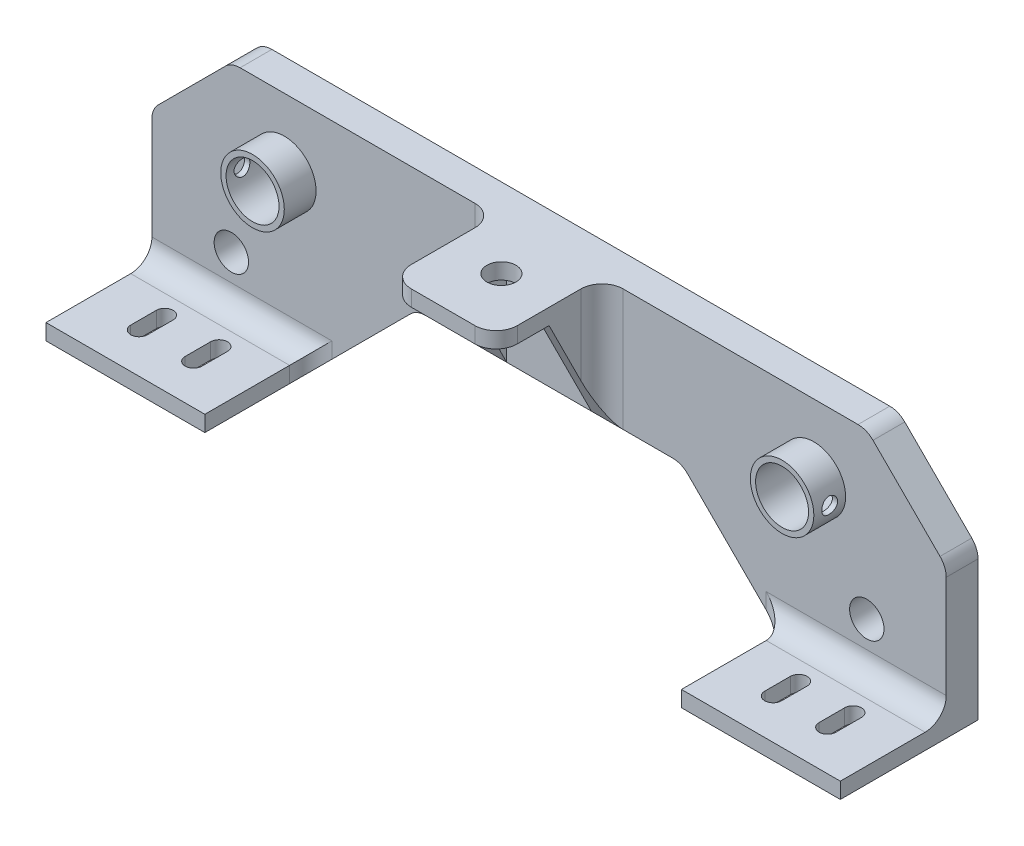
from build123d import *

# Parameters (mm, degrees)
CROQUIS1_R                            = 3.25
CROQUIS1_R_2                          = 5
SALIENTE_EXTRUIR1_DEPTH               = 6
CROQUIS2_R                            = 6
CROQUIS2_R_2                          = 5
SALIENTE_EXTRUIR2_DEPTH               = 6
CROQUIS4_W                            = 20
CROQUIS4_H                            = 3
SALIENTE_EXTRUIR3_DEPTH               = 20
CROQUIS11_R                           = 2.75
CORTAR_EXTRUIR2_DEPTH                 = 10
NERVIO2_REACH                         = 100.742
CROQUIS7_WALL_W                       = 221.844856356
CROQUIS7_WALL_H                       = 2
CROQUIS8_W                            = 30
CROQUIS8_H                            = 3
SALIENTE_EXTRUIR4_DEPTH               = 20
DI_METRO_DE_TALADRO_1_8_0_125_2_DEPTH = 3
CROQUIS12_R                           = 1.5
CORTAR_EXTRUIR3_DEPTH                 = 10
REDONDEO1_R                           = 4


# Read off the part's stored shape, not the designer's step: Diámetro de taladro 1/8 (0.125)2
with BuildPart() as part:
    # Croquis1 → Saliente-Extruir1 (new body)
    with BuildSketch(Plane.XY):
        Polygon((60, 43), (-60, 43), (-75, 28), (-75, 0), (-45, 0), (-25, 20), (25, 20), (45, 0), (75, 0), (75, 28), align=None)
        with Locations((-60, 12)):
            Circle(CROQUIS1_R, mode=Mode.SUBTRACT)
        with Locations((60, 12)):
            Circle(CROQUIS1_R, mode=Mode.SUBTRACT)
        with Locations((-50, 30)):
            Circle(CROQUIS1_R_2, mode=Mode.SUBTRACT)
        with Locations((50, 30)):
            Circle(CROQUIS1_R_2, mode=Mode.SUBTRACT)
    extrude(amount=SALIENTE_EXTRUIR1_DEPTH)

    # Croquis2 → Saliente-Extruir2 (add)
    # profile 1 of 2: a face of its own
    with BuildSketch(Plane.XY.offset(6)):
        with Locations((-50, 30)):
            Circle(CROQUIS2_R)
        with Locations((-50, 30)):
            Circle(CROQUIS2_R_2, mode=Mode.SUBTRACT)
    # profile 2 of 2: a face of its own
    with BuildSketch(Plane.XY.offset(6)):
        with Locations((50, 30)):
            Circle(CROQUIS2_R)
        with Locations((50, 30)):
            Circle(CROQUIS2_R_2, mode=Mode.SUBTRACT)
    extrude(amount=SALIENTE_EXTRUIR2_DEPTH)

    # Croquis4 → Saliente-Extruir3 (add)
    with BuildSketch(Plane.XY.offset(6)):
        with Locations((0, 41.5)):
            Rectangle(CROQUIS4_W, CROQUIS4_H)
    extrude(amount=SALIENTE_EXTRUIR3_DEPTH)

    # Croquis11 → Cortar-Extruir2 (cut)
    with BuildSketch(Plane(origin=(0, 43, 0), x_dir=(1, 0, 0), z_dir=(0, 1, 0))):
        with Locations(Location((0, -15, 0), (0, 0, 180))):
            Circle(CROQUIS11_R)
    extrude(amount=-CORTAR_EXTRUIR2_DEPTH, mode=Mode.SUBTRACT)

    # Croquis7 wall → Nervio2 (add, up to next)
    with BuildSketch(Plane(origin=(-10, 30, 11), x_dir=(0, -0.894427191, -0.4472135955), z_dir=(0, -0.4472135955, 0.894427191)), mode=Mode.PRIVATE) as nervio2_sk1:
        with Locations((0, 1)):
            Rectangle(CROQUIS7_WALL_W, CROQUIS7_WALL_H)
    nervio2_tool1 = extrude(nervio2_sk1.sketch, amount=-NERVIO2_REACH, mode=Mode.PRIVATE) - part.part
    nervio2 = nervio2_tool1.solids().sort_by_distance((-10, 30, 11))[0]
    add(nervio2)

    # Croquis8 → Saliente-Extruir4 (add)
    with BuildSketch(Plane.XY.offset(6)):
        with Locations((-60, 1.5)):
            Rectangle(CROQUIS8_W, CROQUIS8_H)
    saliente_extruir4 = extrude(amount=SALIENTE_EXTRUIR4_DEPTH)

    # Diámetro de taladro 1/8 (0.125)2 outline → Diámetro de taladro 1/8 (0.125)2 (cut)
    with BuildSketch(Plane(origin=(0, 0, 0), x_dir=(1, 0, 0), z_dir=(0, 1, 0))):
        with BuildLine():
            Line((-53.142177149, -18.4125), (-53.142177149, -13.5875))
            ThreePointArc((-53.142177149, -13.5875), (-54.729677149, -12), (-56.317177149, -13.5875))
            Line((-56.317177149, -13.5875), (-56.317177149, -18.4125))
            ThreePointArc((-56.317177149, -18.4125), (-54.729677149, -20), (-53.142177149, -18.4125))
        make_face()
        with BuildLine():
            Line((-63.4125, -18.4125), (-63.4125, -13.5875))
            ThreePointArc((-63.4125, -13.5875), (-65, -12), (-66.5875, -13.5875))
            Line((-66.5875, -13.5875), (-66.5875, -18.4125))
            ThreePointArc((-66.5875, -18.4125), (-65, -20), (-63.4125, -18.4125))
        make_face()
    di_metro_de_taladro_1_8_0_125_2 = extrude(amount=DI_METRO_DE_TALADRO_1_8_0_125_2_DEPTH, mode=Mode.SUBTRACT)

    # Croquis12 → Cortar-Extruir3 (cut)
    with BuildSketch(Plane(origin=(-50, 0, 0), x_dir=(0, 0, -1), z_dir=(1, 0, 0))):
        with Locations(Location((-9, 30, 0), (0, 0, 180))):
            Circle(CROQUIS12_R)
    cortar_extruir3 = extrude(amount=-CORTAR_EXTRUIR3_DEPTH, mode=Mode.SUBTRACT)

    # Simetría2: Nervio2, Saliente-Extruir4, Diámetro de taladro 1/8 (0.125)2, Cortar-Extruir3 across plane
    add(nervio2.mirror(Plane(origin=(0, 0, 0), x_dir=(0, 0, 1), z_dir=(1, 0, 0))))
    add(saliente_extruir4.mirror(Plane(origin=(0, 0, 0), x_dir=(0, 0, 1), z_dir=(1, 0, 0))))
    add(di_metro_de_taladro_1_8_0_125_2.mirror(Plane(origin=(0, 0, 0), x_dir=(0, 0, 1), z_dir=(1, 0, 0))), mode=Mode.SUBTRACT)
    add(cortar_extruir3.mirror(Plane(origin=(0, 0, 0), x_dir=(0, 0, 1), z_dir=(1, 0, 0))), mode=Mode.SUBTRACT)

    # Redondeo1
    # the kernel refuses this fillet: 4 mm, written as the material it adds along each edge
    with BuildSketch(Plane(origin=(-45, 3, 6), x_dir=(0, 1, 0), z_dir=(-1, 0, 0))) as redondeo1_piece_1:
        with BuildLine():
            CenterArc((REDONDEO1_R, -REDONDEO1_R), REDONDEO1_R, 90, 90)
            Line((0, -REDONDEO1_R), (0, 0))
            Line((0, 0), (REDONDEO1_R, 0))
        make_face()
    extrude(amount=30)
    with BuildSketch(Plane(origin=(45, 0, 6), x_dir=(-1, 0, 0), z_dir=(0, 1, 0))) as redondeo1_piece_2_section:
        with BuildLine():
            CenterArc((REDONDEO1_R, REDONDEO1_R), REDONDEO1_R, 180, 90)
            Line((0, REDONDEO1_R), (0, 0))
            Line((0, 0), (REDONDEO1_R, 0))
        make_face()
    redondeo1_piece_2 = extrude(amount=3, mode=Mode.PRIVATE)
    redondeo1_piece_2 = split(redondeo1_piece_2, bisect_by=Plane(origin=(43.821771507, 1.178228493, 7.107331066), z_dir=(0.7071067811865477, 0.7071067811865474, 0)), keep=Keep.TOP, mode=Mode.PRIVATE)
    add(redondeo1_piece_2)
    with BuildSketch(Plane(origin=(45, 3, 6), x_dir=(0, 1, 0), z_dir=(1, 0, 0))) as redondeo1_piece_3:
        with BuildLine():
            CenterArc((REDONDEO1_R, REDONDEO1_R), REDONDEO1_R, 180, 90)
            Line((0, REDONDEO1_R), (0, 0))
            Line((0, 0), (REDONDEO1_R, 0))
        make_face()
    extrude(amount=30)
    with BuildSketch(Plane(origin=(-25, 20, 0), x_dir=(-0.7071067811865421, -0.7071067811865528, 0), z_dir=(0, 0, 1)), Plane(origin=(25, 20, 0), x_dir=(-1, 0, 0), z_dir=(0, 0, 1))) as redondeo1_piece_4:
        with BuildLine():
            CenterArc((REDONDEO1_R * 0.414213562373, REDONDEO1_R), REDONDEO1_R, 225, 45)
            Line((-REDONDEO1_R * 0.292893218813, REDONDEO1_R * 0.292893218813), (0, 0))
            Line((0, 0), (REDONDEO1_R * 0.414213562373, 0))
        make_face()
    extrude(amount=6)
    with BuildSketch(Plane(origin=(-10, 20, 6), x_dir=(-1, 0, 0), z_dir=(0, 1, 0))) as redondeo1_piece_5_section:
        with BuildLine():
            CenterArc((REDONDEO1_R, REDONDEO1_R), REDONDEO1_R, 180, 90)
            Line((0, REDONDEO1_R), (0, 0))
            Line((0, 0), (REDONDEO1_R, 0))
        make_face()
    redondeo1_piece_5 = extrude(amount=23, mode=Mode.PRIVATE)
    redondeo1_piece_5 = split(redondeo1_piece_5, bisect_by=Plane(origin=(-10.946740329, 30.205569968, 11.102784984), z_dir=(0, 0.447213595499958, -0.894427190999916)), keep=Keep.TOP, mode=Mode.PRIVATE)
    add(redondeo1_piece_5)
    with BuildSketch(Plane(origin=(10, 43, 6), x_dir=(1, 0, 0), z_dir=(0, -1, 0))) as redondeo1_piece_6_section:
        with BuildLine():
            CenterArc((REDONDEO1_R, REDONDEO1_R), REDONDEO1_R, 180, 90)
            Line((0, REDONDEO1_R), (0, 0))
            Line((0, 0), (REDONDEO1_R, 0))
        make_face()
    redondeo1_piece_6 = extrude(amount=23, mode=Mode.PRIVATE)
    redondeo1_piece_6 = split(redondeo1_piece_6, bisect_by=Plane(origin=(10.946740329, 30.205569968, 11.102784984), z_dir=(0, 0.447213595499958, -0.894427190999916)), keep=Keep.TOP, mode=Mode.PRIVATE)
    add(redondeo1_piece_6)
    with BuildSketch(Plane(origin=(-45, 0, 6), x_dir=(1, 0, 0), z_dir=(0, 1, 0))) as redondeo1_piece_7_section:
        with BuildLine():
            CenterArc((REDONDEO1_R, -REDONDEO1_R), REDONDEO1_R, 90, 90)
            Line((0, -REDONDEO1_R), (0, 0))
            Line((0, 0), (REDONDEO1_R, 0))
        make_face()
    redondeo1_piece_7 = extrude(amount=3, mode=Mode.PRIVATE)
    redondeo1_piece_7 = split(redondeo1_piece_7, bisect_by=Plane(origin=(-43.821771507, 1.178228493, 7.107331066), z_dir=(-0.7071067811865537, 0.7071067811865415, 0)), keep=Keep.TOP, mode=Mode.PRIVATE)
    add(redondeo1_piece_7)
    with BuildSketch(Plane(origin=(-45, 0, 6), x_dir=(1, 0, 0), z_dir=(0, 1, 0))) as redondeo1_piece_8a_section:
        with BuildLine():
            CenterArc((REDONDEO1_R, -REDONDEO1_R), REDONDEO1_R, 90, 90)
            Line((0, -REDONDEO1_R), (0, 0))
            Line((0, 0), (REDONDEO1_R, 0))
        make_face()
    redondeo1_piece_8a = extrude(amount=13, mode=Mode.PRIVATE)
    redondeo1_piece_8a = split(redondeo1_piece_8a, bisect_by=Plane(origin=(-40.545977817, 4.454022183, 6.906735099), z_dir=(-0.7071067811865537, 0.7071067811865415, 0)), keep=Keep.TOP, mode=Mode.PRIVATE)
    redondeo1_piece_8a = split(redondeo1_piece_8a, bisect_by=Plane(origin=(-44.097771326, 3, 6.906735099), z_dir=(0, 1, 0)), keep=Keep.TOP, mode=Mode.PRIVATE)
    with BuildSketch(Plane(origin=(-35, 3, 6), x_dir=(0, 1, 0), z_dir=(-1, 0, 0))) as redondeo1_piece_8b_section:
        with BuildLine():
            CenterArc((REDONDEO1_R, -REDONDEO1_R), REDONDEO1_R, 90, 90)
            Line((0, -REDONDEO1_R), (0, 0))
            Line((0, 0), (REDONDEO1_R, 0))
        make_face()
    redondeo1_piece_8b = extrude(amount=40, mode=Mode.PRIVATE)
    redondeo1_piece_8b = split(redondeo1_piece_8b, bisect_by=Plane(origin=(-41.928013954, 3.071986046, 6.793098492), z_dir=(-0.7071067811865537, 0.7071067811865415, 0)), keep=Keep.TOP, mode=Mode.PRIVATE)
    redondeo1_piece_8b = split(redondeo1_piece_8b, bisect_by=Plane(origin=(-45, 4.095981395, 6.793098492), z_dir=(1, 0, 0)), keep=Keep.TOP, mode=Mode.PRIVATE)
    redondeo1_piece_8 = redondeo1_piece_8a & redondeo1_piece_8b
    add(redondeo1_piece_8)
    with BuildSketch(Plane(origin=(35, 3, 6), x_dir=(0, 1, 0), z_dir=(1, 0, 0))) as redondeo1_piece_9a_section:
        with BuildLine():
            CenterArc((REDONDEO1_R, REDONDEO1_R), REDONDEO1_R, 180, 90)
            Line((0, REDONDEO1_R), (0, 0))
            Line((0, 0), (REDONDEO1_R, 0))
        make_face()
    redondeo1_piece_9a = extrude(amount=40, mode=Mode.PRIVATE)
    redondeo1_piece_9a = split(redondeo1_piece_9a, bisect_by=Plane(origin=(41.928013954, 3.071986046, 6.793098492), z_dir=(0.7071067811865477, 0.7071067811865474, 0)), keep=Keep.TOP, mode=Mode.PRIVATE)
    redondeo1_piece_9a = split(redondeo1_piece_9a, bisect_by=Plane(origin=(45, 4.095981395, 6.793098492), z_dir=(-1, 0, 0)), keep=Keep.TOP, mode=Mode.PRIVATE)
    with BuildSketch(Plane(origin=(45, 0, 6), x_dir=(-1, 0, 0), z_dir=(0, 1, 0))) as redondeo1_piece_9b_section:
        with BuildLine():
            CenterArc((REDONDEO1_R, REDONDEO1_R), REDONDEO1_R, 180, 90)
            Line((0, REDONDEO1_R), (0, 0))
            Line((0, 0), (REDONDEO1_R, 0))
        make_face()
    redondeo1_piece_9b = extrude(amount=13, mode=Mode.PRIVATE)
    redondeo1_piece_9b = split(redondeo1_piece_9b, bisect_by=Plane(origin=(40.545977817, 4.454022183, 6.906735099), z_dir=(0.7071067811865477, 0.7071067811865474, 0)), keep=Keep.TOP, mode=Mode.PRIVATE)
    redondeo1_piece_9b = split(redondeo1_piece_9b, bisect_by=Plane(origin=(44.097771326, 3, 6.906735099), z_dir=(0, 1, 0)), keep=Keep.TOP, mode=Mode.PRIVATE)
    redondeo1_piece_9 = redondeo1_piece_9a & redondeo1_piece_9b
    add(redondeo1_piece_9)
    # the kernel refuses this fillet: 4 mm, written as the material it takes off along each edge
    with BuildSketch(Plane(origin=(-75, 28, -4.142135624), x_dir=(0, -1, 0), z_dir=(0, 0, 1)), Plane(origin=(60, 43, -4.142135624), x_dir=(-1, 0, 0), z_dir=(0, 0, 1))) as redondeo1_2_piece_1:
        with BuildLine():
            CenterArc((REDONDEO1_R * 0.414213562373, REDONDEO1_R), REDONDEO1_R, 225, 45)
            Line((-REDONDEO1_R * 0.292893218813, REDONDEO1_R * 0.292893218813), (0, 0))
            Line((0, 0), (REDONDEO1_R * 0.414213562373, 0))
        make_face()
    extrude(amount=14.284271247, mode=Mode.SUBTRACT)
    with BuildSketch(Plane(origin=(-60, 43, -4.142135624), x_dir=(1, 0, 0), z_dir=(0, 0, 1)), Plane(origin=(75, 28, -4.142135624), x_dir=(0, -1, 0), z_dir=(0, 0, 1))) as redondeo1_2_piece_2:
        with BuildLine():
            CenterArc((REDONDEO1_R * 0.414213562373, -REDONDEO1_R), REDONDEO1_R, 90, 45)
            Line((-REDONDEO1_R * 0.292893218813, -REDONDEO1_R * 0.292893218813), (0, 0))
            Line((0, 0), (REDONDEO1_R * 0.414213562373, 0))
        make_face()
    extrude(amount=14.284271247, mode=Mode.SUBTRACT)
    with BuildSketch(Plane(origin=(-10, 30, 26), x_dir=(0, 0, -1), z_dir=(0, 1, 0))) as redondeo1_2_piece_3:
        with BuildLine():
            CenterArc((REDONDEO1_R, -REDONDEO1_R), REDONDEO1_R, 90, 90)
            Line((0, -REDONDEO1_R), (0, 0))
            Line((0, 0), (REDONDEO1_R, 0))
        make_face()
    extrude(amount=23, mode=Mode.SUBTRACT)
    with BuildSketch(Plane(origin=(10, 53, 26), x_dir=(-1, 0, 0), z_dir=(0, -1, 0))) as redondeo1_2_piece_4:
        with BuildLine():
            CenterArc((REDONDEO1_R, REDONDEO1_R), REDONDEO1_R, 180, 90)
            Line((0, REDONDEO1_R), (0, 0))
            Line((0, 0), (REDONDEO1_R, 0))
        make_face()
    extrude(amount=23, mode=Mode.SUBTRACT)


solid = part.part
